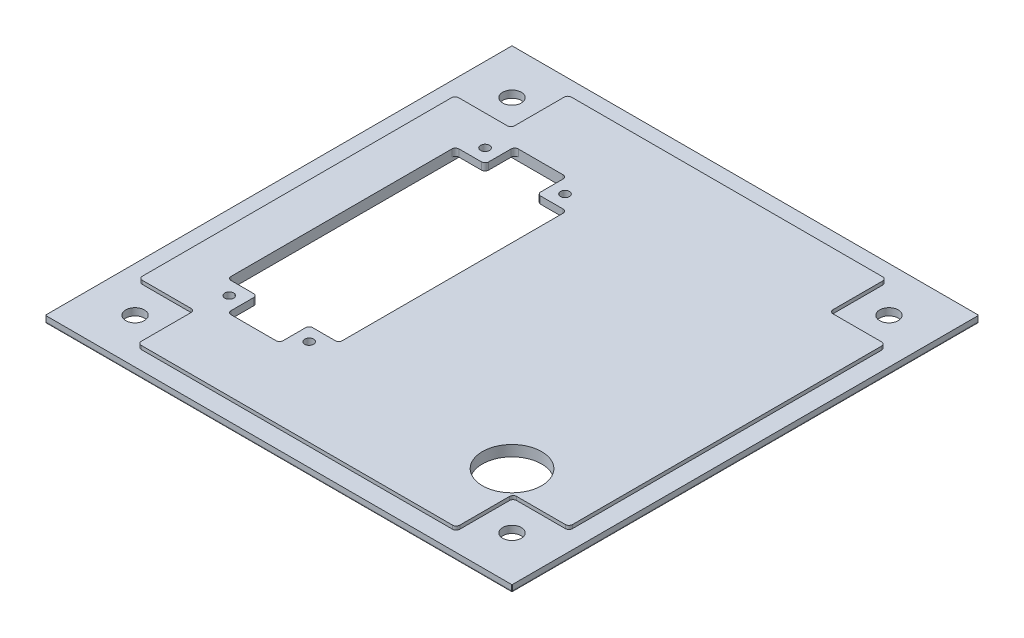
from build123d import *

# Parameters (mm, degrees)
SKETCH_1_W          = 130
SKETCH_1_H          = 130
EXTRUDE_1_DEPTH     = 3
SKETCH_2_R          = 2.6
CUT_EXTRUDE_1_DEPTH = 92.972822073
SKETCH_4_W          = 20.650518397
SKETCH_4_H          = 20.951555191
CUT_EXTRUDE_2_DEPTH = 1
SKETCH_5_W          = 88.698963206
SKETCH_5_H          = 5.1
SKETCH_5_W_2        = 5.1
SKETCH_5_H_2        = 88.096889618
CUT_EXTRUDE_3_DEPTH = 1
CUT_EXTRUDE_4_DEPTH = 3
EXTRUDE_START       = -2
SKETCH_7_R          = 1.25
EXTRUDE_2_DEPTH     = 2
FILLET_1_R          = 1
SKETCH_15_R         = 8.25
CUT_EXTRUDE_9_DEPTH = 92.972822073
CHAMFER_2_SIZE      = 0.2
FILLET_2_R          = 0.5
FILLET_3_R          = 1
FILLET_4_R          = 1


with BuildPart() as part:
    # 草图1 → 凸台-拉伸1 (new body)
    with BuildSketch(Plane(origin=(0, 0, 0), x_dir=(1, 0, 0), z_dir=(0, 1, 0))):
        Rectangle(SKETCH_1_W, SKETCH_1_H)
    extrude(amount=EXTRUDE_1_DEPTH)

    # 草图2 → 切除-拉伸1 (cut, through all)
    with BuildSketch(Plane(origin=(0, 3, 0), x_dir=(1, 0, 0), z_dir=(0, 1, 0))):
        with Locations(Location((52.5, 52.5, 0), (0, 0, 270))):
            Circle(SKETCH_2_R)
        with Locations(Location((52.5, -52.5, 0), (0, 0, 270))):
            Circle(SKETCH_2_R)
        with Locations(Location((-52.5, -52.5, 0), (0, 0, 270))):
            Circle(SKETCH_2_R)
        with Locations(Location((-52.5, 52.5, 0), (0, 0, 270))):
            Circle(SKETCH_2_R)
    extrude(amount=-CUT_EXTRUDE_1_DEPTH, mode=Mode.SUBTRACT)

    # 草图4 → 切除-拉伸2 (cut)
    with BuildSketch(Plane(origin=(0, 3, 0), x_dir=(1, 0, 0), z_dir=(0, 1, 0))):
        with Locations((54.674740802, 54.524222405)):
            Rectangle(SKETCH_4_W, SKETCH_4_H)
        with Locations((-54.674740802, -54.524222405)):
            Rectangle(SKETCH_4_W, SKETCH_4_H)
        with Locations((54.674740802, -54.524222405)):
            Rectangle(SKETCH_4_W, SKETCH_4_H)
        with Locations((-54.674740802, 54.524222405)):
            Rectangle(SKETCH_4_W, SKETCH_4_H)
    extrude(amount=-CUT_EXTRUDE_2_DEPTH, mode=Mode.SUBTRACT)

    # 草图5 → 切除-拉伸3 (cut)
    with BuildSketch(Plane(origin=(0, 3, 0), x_dir=(1, 0, 0), z_dir=(0, 1, 0))):
        with Locations((0, 62.45)):
            Rectangle(SKETCH_5_W, SKETCH_5_H)
        with Locations((62.45, 0)):
            Rectangle(SKETCH_5_W_2, SKETCH_5_H_2)
        with Locations((0, -62.45)):
            Rectangle(SKETCH_5_W, SKETCH_5_H)
        with Locations((-62.45, 0)):
            Rectangle(SKETCH_5_W_2, SKETCH_5_H_2)
    extrude(amount=-CUT_EXTRUDE_3_DEPTH, mode=Mode.SUBTRACT)

    # 草图6 → 切除-拉伸4 (cut)
    with BuildSketch(Plane(origin=(0, 0, 0), x_dir=(-1, 0, 0), z_dir=(0, -1, 0))):
        with BuildLine():
            Line((47.5, -35), (47.5, 35))
            ThreePointArc((47.5, 35), (46.035533906, 38.535533906), (42.5, 40))
            Line((42.5, 40), (21.5, 40))
            ThreePointArc((21.5, 40), (17.964466094, 38.535533906), (16.5, 35))
            Line((16.5, 35), (16.5, -35))
            ThreePointArc((16.5, -35), (17.964466094, -38.535533906), (21.5, -40))
            Line((21.5, -40), (42.5, -40))
            ThreePointArc((42.5, -40), (46.035533906, -38.535533906), (47.5, -35))
        make_face()
    extrude(amount=-CUT_EXTRUDE_4_DEPTH, mode=Mode.SUBTRACT)

    # 草图7 → 凸台-拉伸2 (add)
    # profile 1 of 4: a face of its own
    with BuildSketch(Plane(origin=(0, 3, 0), x_dir=(1, 0, 0), z_dir=(0, 1, 0)).offset(EXTRUDE_START)):
        with BuildLine():
            Line((-24.75, 40), (-24.75, 31.75))
            Line((-24.75, 31.75), (-16.5, 31.75))
            Line((-16.5, 31.75), (-16.5, 35))
            ThreePointArc((-16.5, 35), (-17.964466094, 38.535533906), (-21.5, 40))
            Line((-21.5, 40), (-24.75, 40))
        make_face()
        with Locations(Location((-20.872307757, 35.627692243, 0), (0, 0, 270))):
            Circle(SKETCH_7_R, mode=Mode.SUBTRACT)
    # profile 2 of 4: a face of its own
    with BuildSketch(Plane(origin=(0, 3, 0), x_dir=(1, 0, 0), z_dir=(0, 1, 0)).offset(EXTRUDE_START)):
        with BuildLine():
            Line((-16.5, -31.75), (-24.75, -31.75))
            Line((-24.75, -31.75), (-24.75, -40))
            Line((-24.75, -40), (-21.5, -40))
            ThreePointArc((-21.5, -40), (-17.964466094, -38.535533906), (-16.5, -35))
            Line((-16.5, -35), (-16.5, -31.75))
        make_face()
        with Locations(Location((-20.872307757, -35.627692243, 0), (0, 0, 270))):
            Circle(SKETCH_7_R, mode=Mode.SUBTRACT)
    # profile 3 of 4: a face of its own
    with BuildSketch(Plane(origin=(0, 3, 0), x_dir=(1, 0, 0), z_dir=(0, 1, 0)).offset(EXTRUDE_START)):
        with BuildLine():
            Line((-39.25, -40), (-39.25, -31.75))
            Line((-39.25, -31.75), (-47.5, -31.75))
            Line((-47.5, -31.75), (-47.5, -35))
            ThreePointArc((-47.5, -35), (-46.035533906, -38.535533906), (-42.5, -40))
            Line((-42.5, -40), (-39.25, -40))
        make_face()
        with Locations(Location((-43.127692243, -35.627692243, 0), (0, 0, 270))):
            Circle(SKETCH_7_R, mode=Mode.SUBTRACT)
    # profile 4 of 4: a face of its own
    with BuildSketch(Plane(origin=(0, 3, 0), x_dir=(1, 0, 0), z_dir=(0, 1, 0)).offset(EXTRUDE_START)):
        with BuildLine():
            Line((-47.5, 31.75), (-39.25, 31.75))
            Line((-39.25, 31.75), (-39.25, 40))
            Line((-39.25, 40), (-42.5, 40))
            ThreePointArc((-42.5, 40), (-46.035533906, 38.535533906), (-47.5, 35))
            Line((-47.5, 35), (-47.5, 31.75))
        make_face()
        with Locations(Location((-43.127692243, 35.627692243, 0), (0, 0, 270))):
            Circle(SKETCH_7_R, mode=Mode.SUBTRACT)
    extrude(amount=EXTRUDE_2_DEPTH)

    # 圆角1
    fillet_1_edges = [part.edges().sort_by_distance(p)[0] for p in [
        (-24.75, 2, -31.75),
        (-39.25, 2, -31.75),
        (-39.25, 2, 31.75),
        (-24.75, 2, 31.75),
    ]]
    fillet(fillet_1_edges, radius=FILLET_1_R)

    # 草图15 → 切除-拉伸9 (cut, through all)
    with BuildSketch(Plane(origin=(0, 0, 0), x_dir=(-1, 0, 0), z_dir=(0, -1, 0))):
        with Locations(Location((-38, -38, 0), (0, 0, 90))):
            Circle(SKETCH_15_R)
    extrude(amount=-CUT_EXTRUDE_9_DEPTH, mode=Mode.SUBTRACT)

    # 倒角2
    chamfer_2_edges = [part.edges().sort_by_distance(p)[0] for p in [
        (65, 1, 65),
        (-65, 1, 65),
        (-65, 1, -65),
        (65, 1, -65),
    ]]
    chamfer(chamfer_2_edges, length=CHAMFER_2_SIZE)

    # 圆角2
    # the kernel refuses this fillet: 0.5 mm, written as the material it takes off along each edge
    with BuildSketch(Plane(origin=(-66.05, 0, -65), x_dir=(0, 0, 1), z_dir=(1, 0, 0)), Plane(origin=(-65, 0, 66.05), x_dir=(1, 0, 0), z_dir=(0, 0, -1)), Plane(origin=(66.05, 0, 65), x_dir=(0, 0, -1), z_dir=(-1, 0, 0)), Plane(origin=(65, 0, -66.05), x_dir=(-1, 0, 0), z_dir=(0, 0, 1))) as fillet_2_piece_1:
        with BuildLine():
            CenterArc((FILLET_2_R, -FILLET_2_R), FILLET_2_R, 90, 90)
            Line((0, -FILLET_2_R), (0, 0))
            Line((0, 0), (FILLET_2_R, 0))
        make_face()
    extrude(amount=132.1, mode=Mode.SUBTRACT)

    # 圆角3
    fillet_3_edges = [part.edges().sort_by_distance(p)[0] for p in [
        (59.9, 2.5, 44.048444809),
        (59.9, 2.5, -44.048444809),
        (-44.349481603, 2.5, -59.9),
        (44.349481603, 2.5, -59.9),
        (44.349481603, 2.5, 59.9),
        (-44.349481603, 2.5, 59.9),
        (-59.9, 2.5, 44.048444809),
        (-59.9, 2.5, -44.048444809),
        (-44.349481603, 2.5, -44.048444809),
        (-44.349481603, 2.5, 44.048444809),
        (44.349481603, 2.5, 44.048444809),
        (44.349481603, 2.5, -44.048444809),
    ]]
    fillet(fillet_3_edges, radius=FILLET_3_R)

    # 圆角4
    fillet_4_edges = [part.edges().sort_by_distance(p)[0] for p in [
        (-24.75, 2, -40),
        (-16.5, 2, -31.75),
        (-47.5, 2, -31.75),
        (-39.25, 2, -40),
        (-39.25, 2, 40),
        (-47.5, 2, 31.75),
        (-16.5, 2, 31.75),
        (-24.75, 2, 40),
    ]]
    fillet(fillet_4_edges, radius=FILLET_4_R)


solid = part.part
